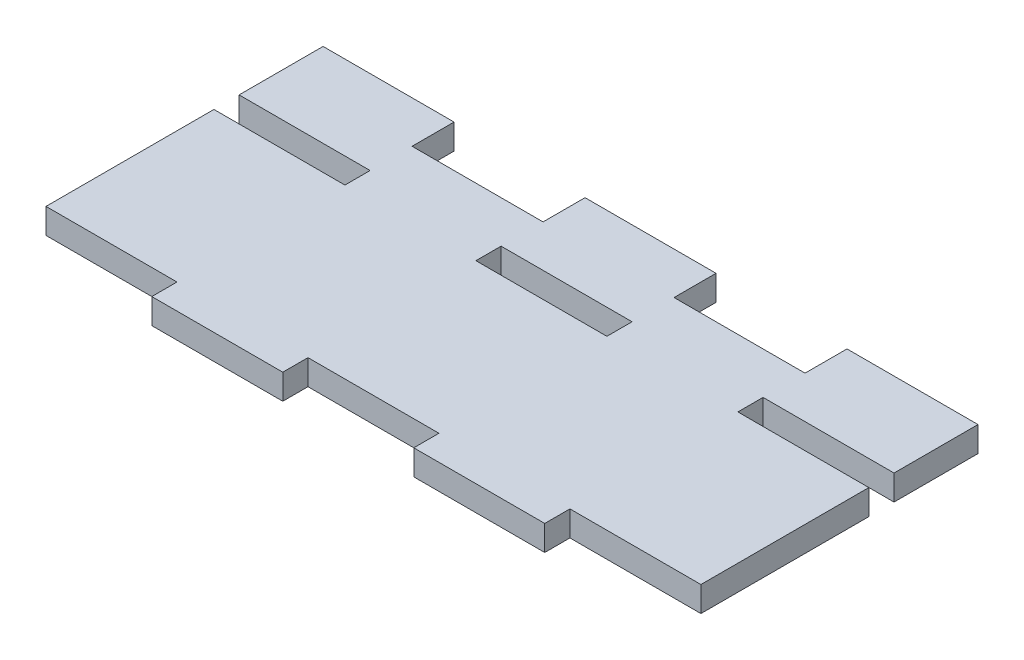
from build123d import *

# Parameters (mm, degrees)
SKETCH1_W           = 15.6
SKETCH1_H           = 3
BOSS_EXTRUDE1_DEPTH = 3


with BuildPart() as part:
    # Sketch1 → Boss-Extrude1 (new body)
    with BuildSketch(Plane(origin=(0, 0, 0), x_dir=(1, 0, 0), z_dir=(0, 1, 0))):
        Polygon((-23.4, 13), (-7.8, 13), (-7.8, 18), (7.8, 18), (7.8, 13), (23.4, 13), (23.4, 18), (39, 18), (39, 8), (23.4, 8), (23.4, 5), (39, 5), (39, -15), (23.4, -15), (23.4, -18), (7.8, -18), (7.8, -15), (-7.8, -15), (-7.8, -18), (-23.4, -18), (-23.4, -15), (-39, -15), (-39, 5), (-23.4, 5), (-23.4, 8), (-39, 8), (-39, 18), (-23.4, 18), align=None)
        with Locations((0, 6.5)):
            Rectangle(SKETCH1_W, SKETCH1_H, mode=Mode.SUBTRACT)
    extrude(amount=BOSS_EXTRUDE1_DEPTH)


solid = part.part
